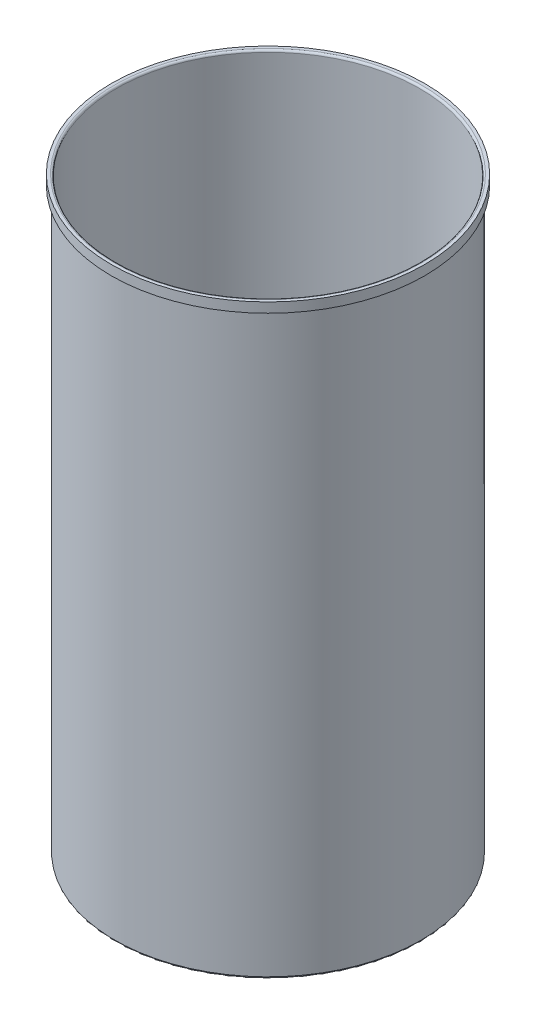
from build123d import *

# Parameters (mm, degrees)
SKETCH3_R           = 198.4375
BOSS_EXTRUDE1_DEPTH = 1.5875
FILLET1_R           = 2.54


with BuildPart() as part:
    # Sweep1: sweep along a path in Sketch1
    with BuildLine(Plane(origin=(0, 0, 0), x_dir=(1, 0, 0), z_dir=(0, 1, 0))) as sweep1_path:
        CenterArc((0, 0), 196.85, 0, 360)
    # Sketch2 → Sweep1 (sweep)
    with BuildSketch(Plane.XY):
        Polygon((196.85, 0), (196.85, 762), (203.2, 762), (203.2, 749.3), (201.6125, 749.3), (201.6125, 760.4125), (198.4375, 760.4125), (198.4375, 0), align=None)
    sweep(path=sweep1_path.line)

    # Sketch3 → Boss-Extrude1 (add)
    with BuildSketch(Plane(origin=(0, 0, 0), x_dir=(-1, 0, 0), z_dir=(0, -1, 0))):
        Circle(SKETCH3_R)
    extrude(amount=BOSS_EXTRUDE1_DEPTH)

    # Fillet1
    fillet1_edges = [part.edges().sort_by_distance(p)[0] for p in [
        (198.4375, -1.5875, 0),
        (-196.85, 762, 0),
    ]]
    fillet(fillet1_edges, radius=FILLET1_R)


solid = part.part
